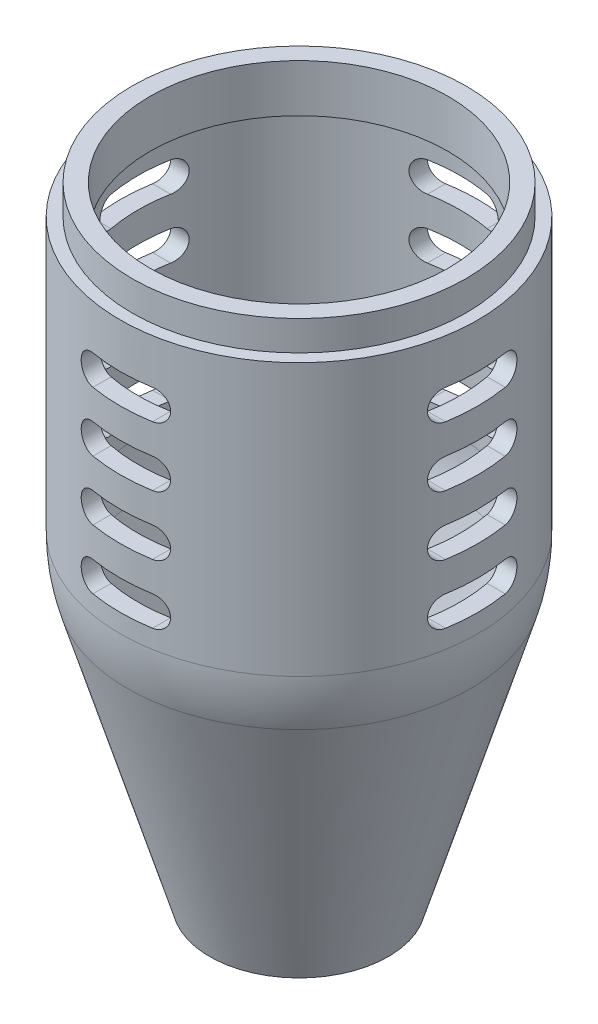
from build123d import *

# Parameters (mm, degrees)
SKETCH2_R                = 28
SKETCH2_R_2              = 25
EXTRUDE_THIN1_DEPTH      = 5
CUT_EXTRUDE1_DEPTH       = 114.247516529
LPATTERN1_COUNT          = 4
LPATTERN1_PITCH          = 10
CIRPATTERN1_COUNT        = 4
CIRPATTERN1_COPY_1_DEPTH = 114.247516529
CIRPATTERN1_COPY_2_DEPTH = 114.247516529
CIRPATTERN1_COPY_3_DEPTH = 114.247516529
CIRPATTERN1_COPY_4_DEPTH = 114.247516529
CIRPATTERN1_COPY_5_DEPTH = 114.247516529
CIRPATTERN1_COPY_6_DEPTH = 114.247516529
CIRPATTERN1_COPY_7_DEPTH = 114.247516529
CIRPATTERN1_COPY_8_DEPTH = 114.247516529
CIRPATTERN1_COPY_9_DEPTH = 114.247516529


# Read off the part's stored shape, not the designer's step: Shell3
with BuildPart() as part:
    # Sketch1 → Revolve1 (revolve)
    with BuildSketch(Plane.XY, mode=Mode.PRIVATE) as revolve1_sk:
        with BuildLine():
            Line((0, 100), (30, 100))
            Line((30, 100), (30, 54.403065089))
            ThreePointArc((30, 54.403065089), (29.682011865, 50.046670749), (28.734788557, 45.782628522))
            Line((28.734788557, 45.782628522), (15, 0))
            Line((15, 0), (0, 0))
            Line((0, 0), (0, 100))
        make_face()
    revolve(revolve1_sk.sketch.rotate(Axis((0, 0, 0), (0, 1, 0)), 90), axis=Axis((0, 0, 0), (0, 1, 0)))

    # Sketch2 → Extrude-Thin1 (add)
    with BuildSketch(Plane(origin=(0, 100, 0), x_dir=(1, 0, 0), z_dir=(0, 1, 0))):
        Circle(SKETCH2_R)
        Circle(SKETCH2_R_2, mode=Mode.SUBTRACT)
    extrude(amount=EXTRUDE_THIN1_DEPTH)

    # Shell3 outline → Shell3 (revolve, cut)
    with BuildSketch(Plane.XY):
        with BuildLine():
            Line((25, 97), (25, 100))
            Line((25, 100), (0, 100))
            Line((0, 100), (0, 0))
            Line((0, 0), (11.867908047, 0))
            Line((11.867908047, 0), (25.861309693, 46.644672153))
            ThreePointArc((25.861309693, 46.644672153), (26.713810678, 50.482310183), (27, 54.403065116))
            Line((27, 54.403065116), (27, 97))
            Line((27, 97), (25, 97))
        make_face()
    revolve(axis=Axis((0, 0, 0), (0, 1, 0)), mode=Mode.SUBTRACT)

    # Sketch4 → Cut-Extrude1 (cut, through all)
    with BuildSketch(Plane.XY):
        with BuildLine():
            Line((-5, 62.5), (5, 62.5))
            ThreePointArc((5, 62.5), (7.5, 60), (5, 57.5))
            Line((5, 57.5), (-5, 57.5))
            ThreePointArc((-5, 57.5), (-7.5, 60), (-5, 62.5))
        make_face()
    cut_extrude1 = extrude(amount=-CUT_EXTRUDE1_DEPTH, mode=Mode.SUBTRACT)

    # LPattern1: Cut-Extrude1 ×4
    with Locations(*[(0, i * LPATTERN1_PITCH, 0) for i in range(1, LPATTERN1_COUNT)]):
        add(cut_extrude1, mode=Mode.SUBTRACT)

    # CirPattern1: Cut-Extrude1 ×4 about axis
    cirpattern1_axis = Axis((0, 105, 0), (0, -1, 0))
    for i in range(1, CIRPATTERN1_COUNT):
        add(cut_extrude1.rotate(cirpattern1_axis, i * 360 / CIRPATTERN1_COUNT), mode=Mode.SUBTRACT)

    # CirPattern1 copy 1 sketch → CirPattern1 copy 1 (cut, through all)
    with BuildSketch(Plane(origin=(0, 10, 0), x_dir=(0, 0, 1), z_dir=(-1, 0, 0))):
        with BuildLine():
            Line((-5, 62.5), (5, 62.5))
            ThreePointArc((5, 62.5), (7.5, 60), (5, 57.5))
            Line((5, 57.5), (-5, 57.5))
            ThreePointArc((-5, 57.5), (-7.5, 60), (-5, 62.5))
        make_face()
    extrude(amount=-CIRPATTERN1_COPY_1_DEPTH, mode=Mode.SUBTRACT)

    # CirPattern1 copy 2 sketch → CirPattern1 copy 2 (cut, through all)
    with BuildSketch(Plane(origin=(0, 10, 0), x_dir=(-1, 0, 0), z_dir=(0, 0, -1))):
        with BuildLine():
            Line((-5, 62.5), (5, 62.5))
            ThreePointArc((5, 62.5), (7.5, 60), (5, 57.5))
            Line((5, 57.5), (-5, 57.5))
            ThreePointArc((-5, 57.5), (-7.5, 60), (-5, 62.5))
        make_face()
    extrude(amount=-CIRPATTERN1_COPY_2_DEPTH, mode=Mode.SUBTRACT)

    # CirPattern1 copy 3 sketch → CirPattern1 copy 3 (cut, through all)
    with BuildSketch(Plane(origin=(0, 10, 0), x_dir=(0, 0, -1), z_dir=(1, 0, 0))):
        with BuildLine():
            Line((-5, 62.5), (5, 62.5))
            ThreePointArc((5, 62.5), (7.5, 60), (5, 57.5))
            Line((5, 57.5), (-5, 57.5))
            ThreePointArc((-5, 57.5), (-7.5, 60), (-5, 62.5))
        make_face()
    extrude(amount=-CIRPATTERN1_COPY_3_DEPTH, mode=Mode.SUBTRACT)

    # CirPattern1 copy 4 sketch → CirPattern1 copy 4 (cut, through all)
    with BuildSketch(Plane(origin=(0, 20, 0), x_dir=(0, 0, 1), z_dir=(-1, 0, 0))):
        with BuildLine():
            Line((-5, 62.5), (5, 62.5))
            ThreePointArc((5, 62.5), (7.5, 60), (5, 57.5))
            Line((5, 57.5), (-5, 57.5))
            ThreePointArc((-5, 57.5), (-7.5, 60), (-5, 62.5))
        make_face()
    extrude(amount=-CIRPATTERN1_COPY_4_DEPTH, mode=Mode.SUBTRACT)

    # CirPattern1 copy 5 sketch → CirPattern1 copy 5 (cut, through all)
    with BuildSketch(Plane(origin=(0, 20, 0), x_dir=(-1, 0, 0), z_dir=(0, 0, -1))):
        with BuildLine():
            Line((-5, 62.5), (5, 62.5))
            ThreePointArc((5, 62.5), (7.5, 60), (5, 57.5))
            Line((5, 57.5), (-5, 57.5))
            ThreePointArc((-5, 57.5), (-7.5, 60), (-5, 62.5))
        make_face()
    extrude(amount=-CIRPATTERN1_COPY_5_DEPTH, mode=Mode.SUBTRACT)

    # CirPattern1 copy 6 sketch → CirPattern1 copy 6 (cut, through all)
    with BuildSketch(Plane(origin=(0, 20, 0), x_dir=(0, 0, -1), z_dir=(1, 0, 0))):
        with BuildLine():
            Line((-5, 62.5), (5, 62.5))
            ThreePointArc((5, 62.5), (7.5, 60), (5, 57.5))
            Line((5, 57.5), (-5, 57.5))
            ThreePointArc((-5, 57.5), (-7.5, 60), (-5, 62.5))
        make_face()
    extrude(amount=-CIRPATTERN1_COPY_6_DEPTH, mode=Mode.SUBTRACT)

    # CirPattern1 copy 7 sketch → CirPattern1 copy 7 (cut, through all)
    with BuildSketch(Plane(origin=(0, 30, 0), x_dir=(0, 0, 1), z_dir=(-1, 0, 0))):
        with BuildLine():
            Line((-5, 62.5), (5, 62.5))
            ThreePointArc((5, 62.5), (7.5, 60), (5, 57.5))
            Line((5, 57.5), (-5, 57.5))
            ThreePointArc((-5, 57.5), (-7.5, 60), (-5, 62.5))
        make_face()
    extrude(amount=-CIRPATTERN1_COPY_7_DEPTH, mode=Mode.SUBTRACT)

    # CirPattern1 copy 8 sketch → CirPattern1 copy 8 (cut, through all)
    with BuildSketch(Plane(origin=(0, 30, 0), x_dir=(-1, 0, 0), z_dir=(0, 0, -1))):
        with BuildLine():
            Line((-5, 62.5), (5, 62.5))
            ThreePointArc((5, 62.5), (7.5, 60), (5, 57.5))
            Line((5, 57.5), (-5, 57.5))
            ThreePointArc((-5, 57.5), (-7.5, 60), (-5, 62.5))
        make_face()
    extrude(amount=-CIRPATTERN1_COPY_8_DEPTH, mode=Mode.SUBTRACT)

    # CirPattern1 copy 9 sketch → CirPattern1 copy 9 (cut, through all)
    with BuildSketch(Plane(origin=(0, 30, 0), x_dir=(0, 0, -1), z_dir=(1, 0, 0))):
        with BuildLine():
            Line((-5, 62.5), (5, 62.5))
            ThreePointArc((5, 62.5), (7.5, 60), (5, 57.5))
            Line((5, 57.5), (-5, 57.5))
            ThreePointArc((-5, 57.5), (-7.5, 60), (-5, 62.5))
        make_face()
    extrude(amount=-CIRPATTERN1_COPY_9_DEPTH, mode=Mode.SUBTRACT)


solid = part.part
